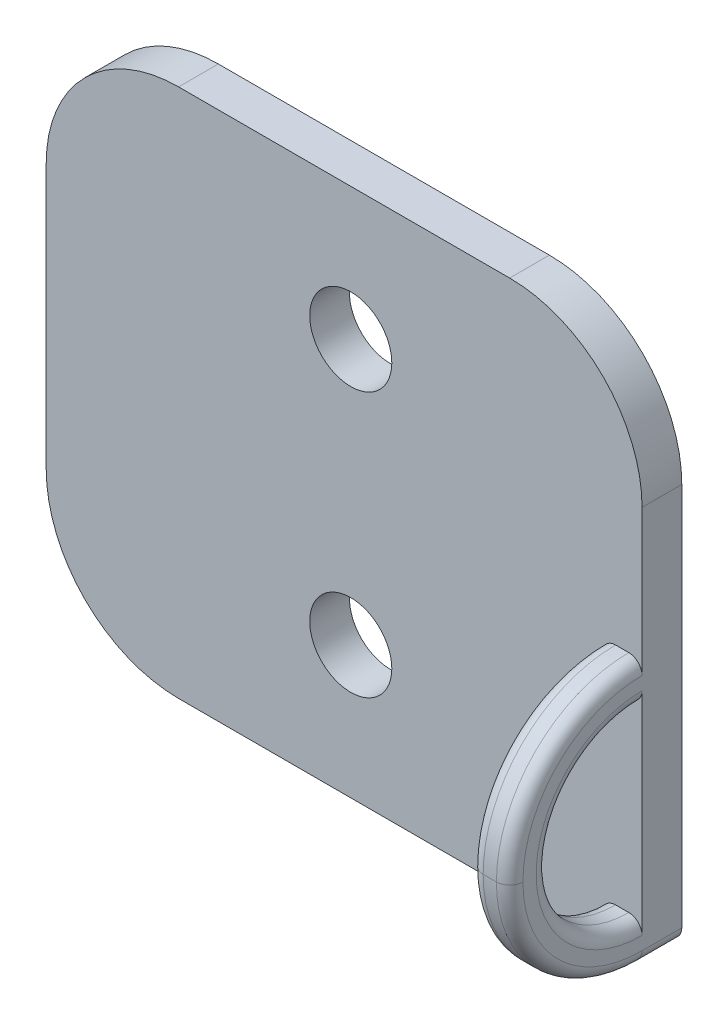
from build123d import *

# Parameters (mm, degrees)
SKETCH1_R           = 3.1
BOSS_EXTRUDE1_DEPTH = 3
SKETCH2_W           = 3
SKETCH2_H           = 20
BOSS_EXTRUDE2_DEPTH = 10
FILLET1_R           = 10
CUT_EXTRUDE1_DEPTH  = 60.439044407
FILLET2_R           = 1


with BuildPart() as part:
    # Sketch1 → Boss-Extrude1 (new body)
    with BuildSketch(Plane.XY):
        with BuildLine():
            Line((10, 0), (45, 0))
            Line((45, 0), (45, 30))
            ThreePointArc((45, 30), (42.071067812, 37.071067812), (35, 40))
            Line((35, 40), (10, 40))
            ThreePointArc((10, 40), (2.928932188, 37.071067812), (0, 30))
            Line((0, 30), (0, 10))
            ThreePointArc((0, 10), (2.928932188, 2.928932188), (10, 0))
        make_face()
        with Locations((23, 30)):
            Circle(SKETCH1_R, mode=Mode.SUBTRACT)
        with Locations((23, 10)):
            Circle(SKETCH1_R, mode=Mode.SUBTRACT)
    extrude(amount=BOSS_EXTRUDE1_DEPTH)

    # Sketch2 → Boss-Extrude2 (add)
    with BuildSketch(Plane.XY.offset(3)):
        with Locations((43.5, 10)):
            Rectangle(SKETCH2_W, SKETCH2_H)
    extrude(amount=BOSS_EXTRUDE2_DEPTH)

    # Fillet1
    fillet1_edges = [part.edges().sort_by_distance(p)[0] for p in [
        (43.5, 0, 13),
        (43.5, 20, 13),
    ]]
    fillet(fillet1_edges, radius=FILLET1_R - 0.0001)  # a hair under: the kernel refuses the full size

    # Sketch3 → Cut-Extrude1 (cut, through all)
    with BuildSketch(Plane.ZY.offset(-42)):
        with BuildLine():
            Line((3, 17), (3, 3))
            ThreePointArc((3, 3), (10, 10), (3, 17))
        make_face()
    extrude(amount=-CUT_EXTRUDE1_DEPTH, mode=Mode.SUBTRACT)

    # Fillet2
    fillet2_edges = [part.edges().sort_by_distance(p)[0] for p in [
        (45, 0, 1.50005),
        (45, 17.071097101, 10.071097101),
        (45, 2.928902899, 10.071097101),
        (42, 17.071097101, 10.071097101),
        (42, 2.928902899, 10.071097101),
        (45, 10, 10),
        (42, 10, 10),
    ]]
    fillet(fillet2_edges, radius=FILLET2_R)


solid = part.part
